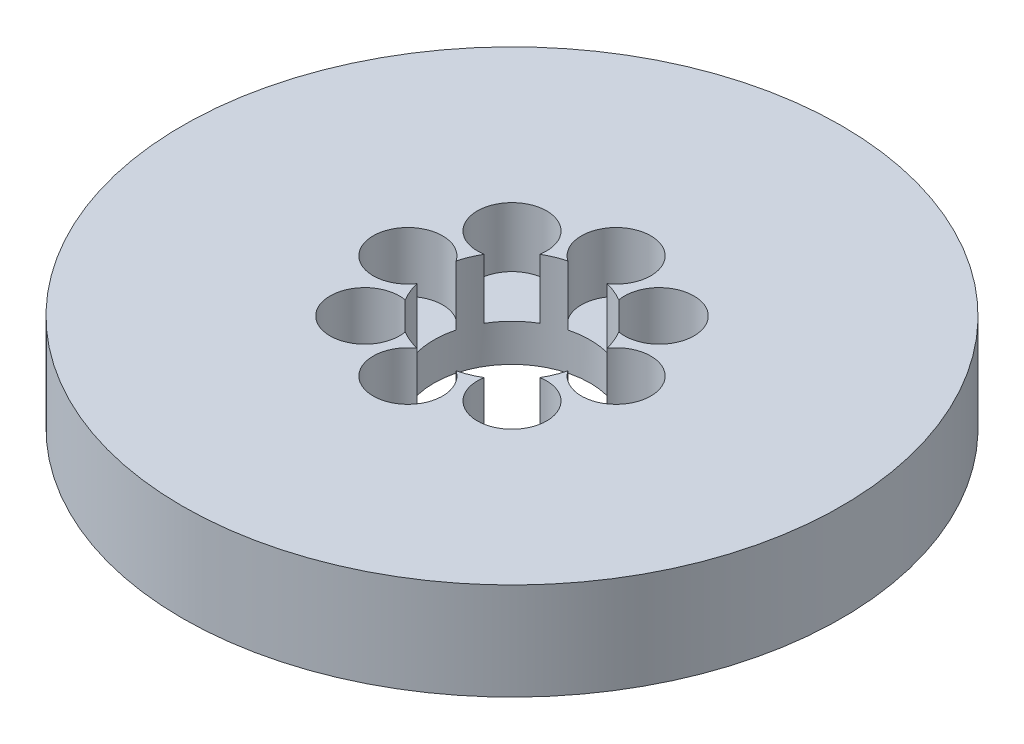
from build123d import *

# Parameters (mm, degrees)
SKETCH1_R           = 95
BOSS_EXTRUDE1_DEPTH = 28
SKETCH2_R           = 22.5
CUT_EXTRUDE1_DEPTH  = 138.237021244
SKETCH3_R           = 10
CUT_EXTRUDE2_DEPTH  = 17.230956985
CIRPATTERN1_COUNT   = 8


with BuildPart() as part:
    # Sketch1 → Boss-Extrude1 (new body)
    with BuildSketch(Plane(origin=(0, 0, 0), x_dir=(1, 0, 0), z_dir=(0, 1, 0))):
        Circle(SKETCH1_R)
    extrude(amount=BOSS_EXTRUDE1_DEPTH)

    # Sketch2 → Cut-Extrude1 (cut, through all)
    with BuildSketch(Plane(origin=(0, 0, 0), x_dir=(1, 0, 0), z_dir=(0, 1, 0))):
        Circle(SKETCH2_R)
    extrude(amount=CUT_EXTRUDE1_DEPTH, mode=Mode.SUBTRACT)

    # Sketch3 → Cut-Extrude2 (cut)
    with BuildSketch(Plane(origin=(0, 28, 0), x_dir=(1, 0, 0), z_dir=(0, 1, 0))):
        with Locations((-30.014816246, 0)):
            Circle(SKETCH3_R)
    cut_extrude2 = extrude(amount=-CUT_EXTRUDE2_DEPTH, mode=Mode.SUBTRACT)

    # CirPattern1: Cut-Extrude2 ×8 about axis
    cirpattern1_axis = Axis((0, 0, 0), (0, 1, 0))
    for i in range(1, CIRPATTERN1_COUNT):
        add(cut_extrude2.rotate(cirpattern1_axis, i * 360 / CIRPATTERN1_COUNT), mode=Mode.SUBTRACT)


solid = part.part
